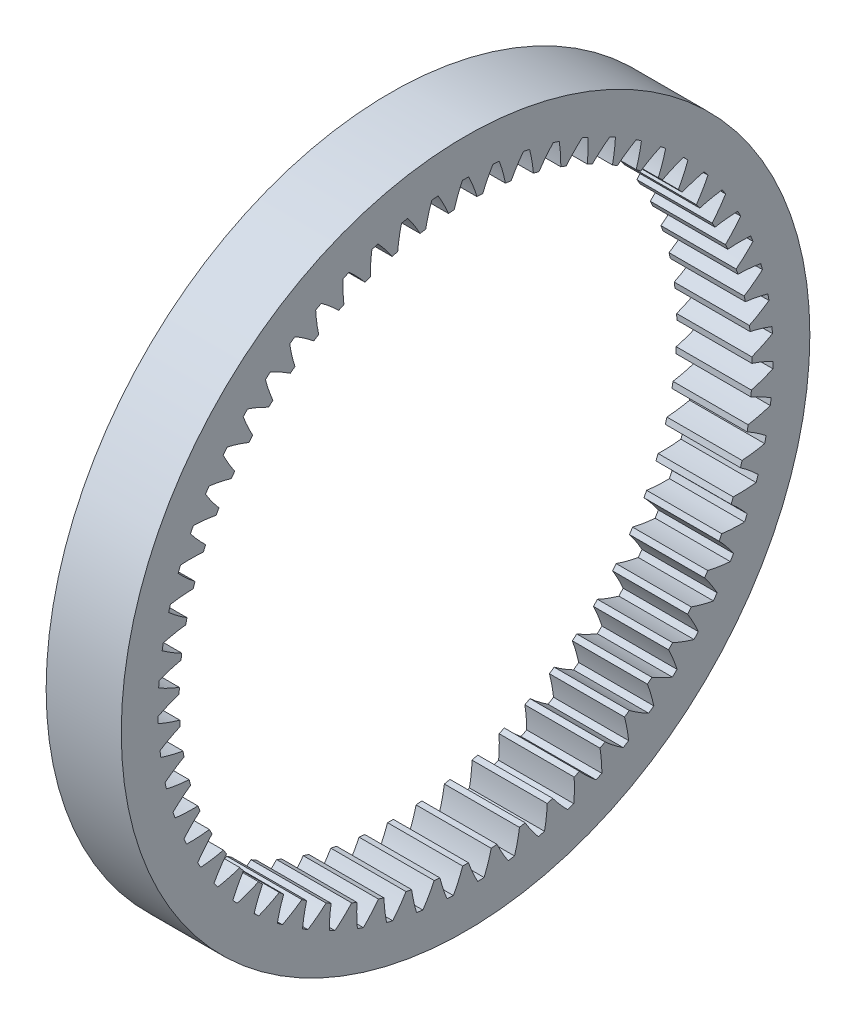
from build123d import *

# Parameters (mm, degrees)
BASPROSKE_W     = 12
BASPROSKE_H     = 9.25
TOOTHCUT_DEPTH  = 79.70196948
TEETHCUTS_COUNT = 63
TEETHCUTS_ANGLE = 354.285714286


with BuildPart() as part:
    # BasProSke → Base-Revolve (revolve)
    with BuildSketch(Plane(origin=(0, 0, 0), x_dir=(1, 0, 0), z_dir=(0, 1, 0))):
        with Locations((6, 50.375)):
            Rectangle(BASPROSKE_W, BASPROSKE_H)
    revolve(axis=Axis((-10, 0, 0), (1, 0, 0)))

    # TooCutSke → ToothCut (cut, through all)
    with BuildSketch(Plane(origin=(0, 0, 0), x_dir=(0, 0, -1), z_dir=(1, 0, 0))):
        with BuildLine():
            ThreePointArc((1.826782425, 45.688093757), (1.234952625, 47.431416657), (0.509169817, 49.123361266))
            ThreePointArc((0.509169817, 49.123361266), (0, 49.126), (-0.509169817, 49.123361266))
            ThreePointArc((-0.509169817, 49.123361266), (-1.234952625, 47.431416657), (-1.826782425, 45.688093757))
            ThreePointArc((-1.826782425, 45.688093757), (0, 45.7246), (1.826782425, 45.688093757))
        make_face()
    toothcut = extrude(amount=TOOTHCUT_DEPTH, mode=Mode.SUBTRACT)

    # TeethCuts: ToothCut ×63 about axis
    teethcuts_axis = Axis((-10, 0, 0), (1, 0, 0))
    for i in range(1, TEETHCUTS_COUNT):
        add(toothcut.rotate(teethcuts_axis, i * TEETHCUTS_ANGLE / (TEETHCUTS_COUNT - 1)), mode=Mode.SUBTRACT)


solid = part.part
